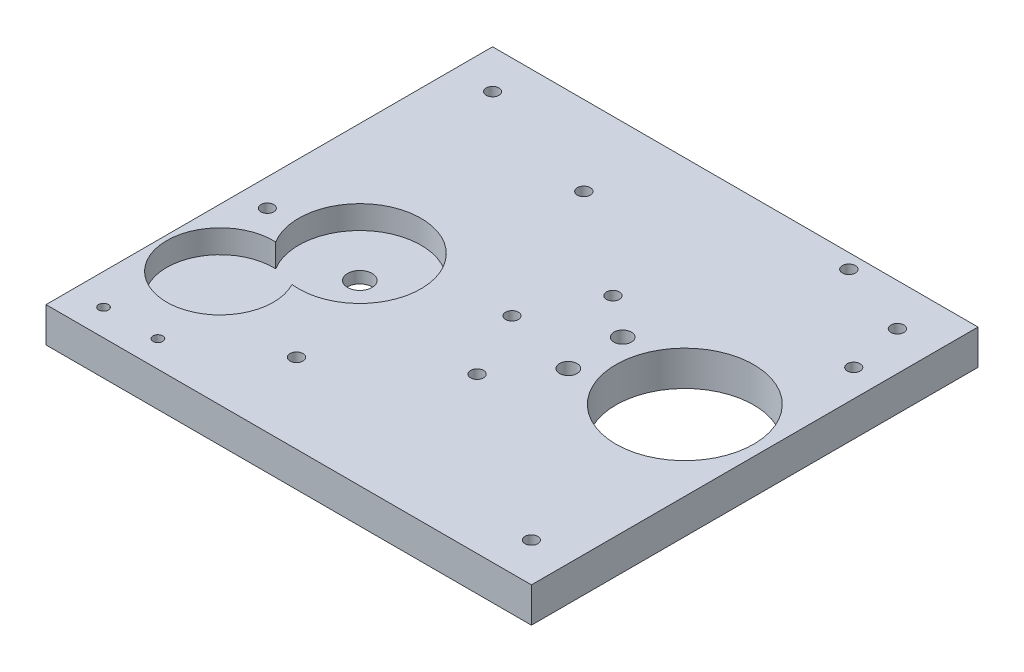
from build123d import *

# Parameters (mm, degrees)
SKETCH1_W                 = 125
SKETCH1_H                 = 115
TOP_BASE_DEPTH            = 9
GEARS_EXTRUDE_CUT_DEPTH   = 6
SKETCH7_R                 = 3.15
KEY_EXTRUDE_CUT_DEPTH     = 171.091152033
SKETCH8_R                 = 17.75
THUMB_EXTRUDE_CUT_DEPTH   = 171.091152033
SKETCH9_R                 = 1.675
SKETCH9_R_2               = 2.25
MOUNT_HOLES_DEPTH         = 5
M3X0_5_TAPPED_HOLE1_D     = 2.5
M3X0_5_TAPPED_HOLE1_DEPTH = 7.5
M3X0_5_TAPPED_HOLE1_TIP   = 0.751075774
M4X0_7_TAPPED_HOLE1_D     = 3.3
M4X0_7_TAPPED_HOLE1_DEPTH = 10.1
M4X0_7_TAPPED_HOLE1_TIP   = 0.991420021


with BuildPart() as part:
    # Sketch1 → Top_Base (new body)
    with BuildSketch(Plane(origin=(0, 0, 0), x_dir=(1, 0, 0), z_dir=(0, 1, 0))):
        with Locations((62.5, 57.5)):
            Rectangle(SKETCH1_W, SKETCH1_H)
    extrude(amount=TOP_BASE_DEPTH)

    # Sketch5 → Gears_Extrude_Cut (cut)
    with BuildSketch(Plane(origin=(0, 9, 0), x_dir=(1, 0, 0), z_dir=(0, 1, 0))):
        with BuildLine():
            ThreePointArc((27.20769188, 36.147558197), (37.485146889, 65.072253006), (15.590335344, 43.557577116))
            ThreePointArc((15.590335344, 43.557577116), (7.605781292, 18.227670419), (27.20769188, 36.147558197))
        make_face()
    extrude(amount=-GEARS_EXTRUDE_CUT_DEPTH, mode=Mode.SUBTRACT)

    # Sketch7 → Key_Extrude_Cut (cut, through all)
    with BuildSketch(Plane(origin=(0, 9, 0), x_dir=(1, 0, 0), z_dir=(0, 1, 0))):
        with Locations((29.01540546, 51.79347369)):
            Circle(SKETCH7_R)
    extrude(amount=-KEY_EXTRUDE_CUT_DEPTH, mode=Mode.SUBTRACT)

    # Sketch8 → Thumb_Extrude_Cut (cut, through all)
    with BuildSketch(Plane(origin=(0, 9, 0), x_dir=(1, 0, 0), z_dir=(0, 1, 0))):
        with Locations((104.5, 60)):
            Circle(SKETCH8_R)
    extrude(amount=-THUMB_EXTRUDE_CUT_DEPTH, mode=Mode.SUBTRACT)

    # Sketch9 → Mount_Holes (cut)
    with BuildSketch(Plane(origin=(0, 9, 0), x_dir=(1, 0, 0), z_dir=(0, 1, 0))):
        with Locations((71, 75)):
            Circle(SKETCH9_R)
        with Locations((44, 94.5)):
            Circle(SKETCH9_R)
        with Locations((81.5, 67)):
            Circle(SKETCH9_R_2)
        with Locations((95.5, 111.25)):
            Circle(SKETCH9_R)
        with Locations((115, 104.25)):
            Circle(SKETCH9_R)
        with Locations((71, 40)):
            Circle(SKETCH9_R)
        with Locations((44, 20.5)):
            Circle(SKETCH9_R)
        with Locations((81.5, 53)):
            Circle(SKETCH9_R_2)
    extrude(amount=-MOUNT_HOLES_DEPTH, mode=Mode.SUBTRACT)

    # M3x0.5 Tapped Hole1
    with Locations(Plane(origin=(8, 9, -6.820255536), x_dir=(0, 0, 1), z_dir=(0, 1, 0))):
        with Locations((0, 0), (0, 14)):
            Hole(M3X0_5_TAPPED_HOLE1_D / 2, depth=M3X0_5_TAPPED_HOLE1_DEPTH)
            with Locations((0, 0, -(M3X0_5_TAPPED_HOLE1_DEPTH + M3X0_5_TAPPED_HOLE1_TIP / 2))):  # 118° drill point
                Cone(0, M3X0_5_TAPPED_HOLE1_D / 2, M3X0_5_TAPPED_HOLE1_TIP, mode=Mode.SUBTRACT)

    # M4x0.7 Tapped Hole1
    with Locations(Plane(origin=(10, 9, -105), x_dir=(0, 0, 1), z_dir=(0, 1, 0))):
        with Locations((0, 0), (15, 108), (95, 105), (55, -3), (47.5, 52.5)):
            Hole(M4X0_7_TAPPED_HOLE1_D / 2, depth=M4X0_7_TAPPED_HOLE1_DEPTH)
            with Locations((0, 0, -(M4X0_7_TAPPED_HOLE1_DEPTH + M4X0_7_TAPPED_HOLE1_TIP / 2))):  # 118° drill point
                Cone(0, M4X0_7_TAPPED_HOLE1_D / 2, M4X0_7_TAPPED_HOLE1_TIP, mode=Mode.SUBTRACT)


solid = part.part
